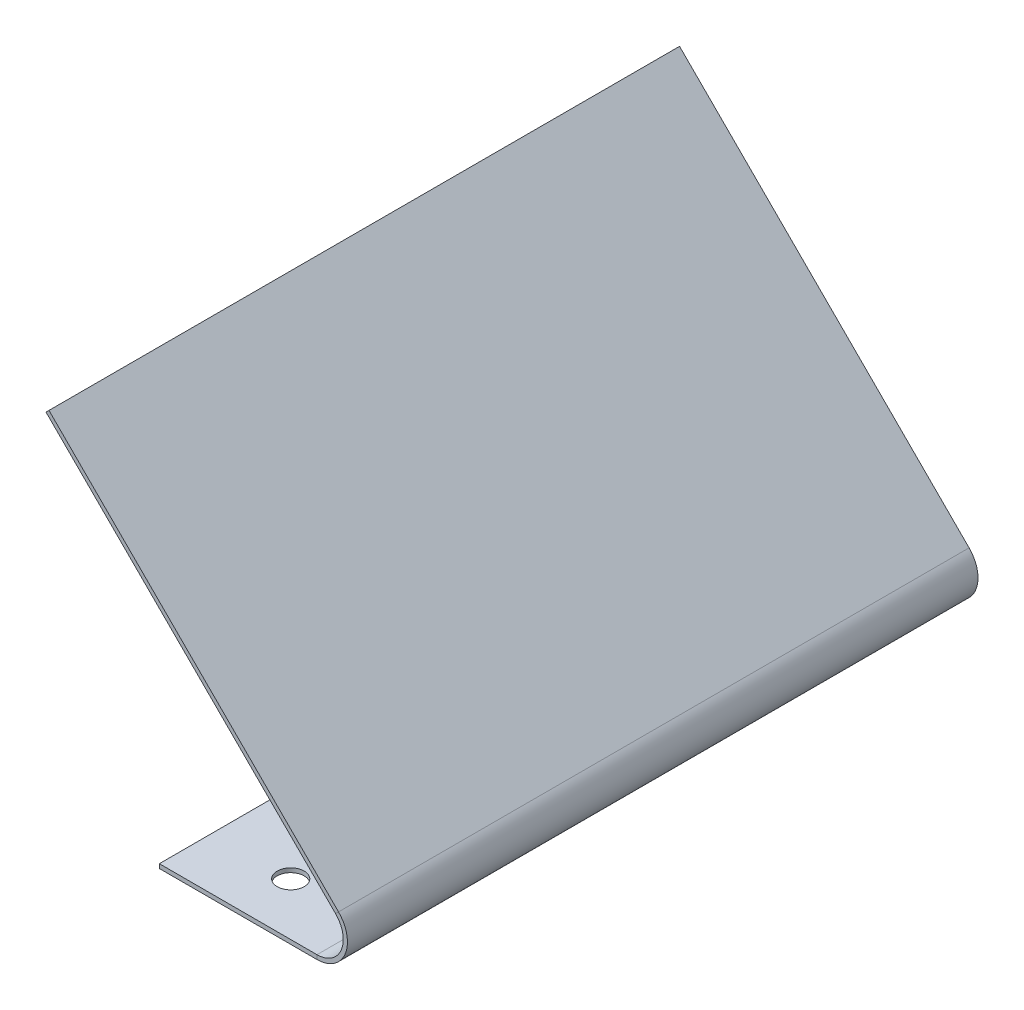
from build123d import *

# Parameters (mm, degrees)
SKETCH2_W                 = 19.05
SKETCH2_H                 = 76.2
BOSS_EXTRUDE2_DEPTH       = 0.508
EDGE_FLANGE2_DEPTH        = 76.2
F_4_CLEARANCE_HOLE1_D     = 3.2639
F_4_CLEARANCE_HOLE1_DEPTH = 0.508


# Sheet-metal steps are written as plain solids
with BuildPart() as part:
    # Sketch2 → Boss-Extrude2 (new body)
    with BuildSketch(Plane(origin=(0, 0, 0), x_dir=(1, 0, 0), z_dir=(0, 1, 0))):
        with Locations((-9.525, 38.1)):
            Rectangle(SKETCH2_W, SKETCH2_H)
    extrude(amount=BOSS_EXTRUDE2_DEPTH)

    # Edge-Flange2 section (across the edge) → Edge-Flange2 (add)
    with BuildSketch(Plane(origin=(7.665128061, 0.508, 0), x_dir=(-0.7071067811865488, -0.7071067811865464, 0), z_dir=(0, 0, -1))):
        with BuildLine():
            Line((-0.508, 7.665128061), (-0.508, 57.15))
            Line((-0.508, 57.15), (0, 57.15))
            Line((0, 57.15), (0, 7.665128061))
            ThreePointArc((0, 7.665128061), (1.959980102, 4.731810545), (5.42006403, 5.42006403))
            Line((5.42006403, 5.42006403), (5.779274275, 5.060853785))
            ThreePointArc((5.779274275, 5.060853785), (1.765576919, 4.262479742), (-0.508, 7.665128061))
        make_face()
    extrude(amount=EDGE_FLANGE2_DEPTH)

    # #4 Clearance Hole1
    with Locations(Plane(origin=(0, 0, 0), x_dir=(-1, 0, 0), z_dir=(0, -1, 0))):
        with Locations((9.525, 69.85), (9.525, 6.35)):
            Hole(F_4_CLEARANCE_HOLE1_D / 2, depth=F_4_CLEARANCE_HOLE1_DEPTH)


solid = part.part
